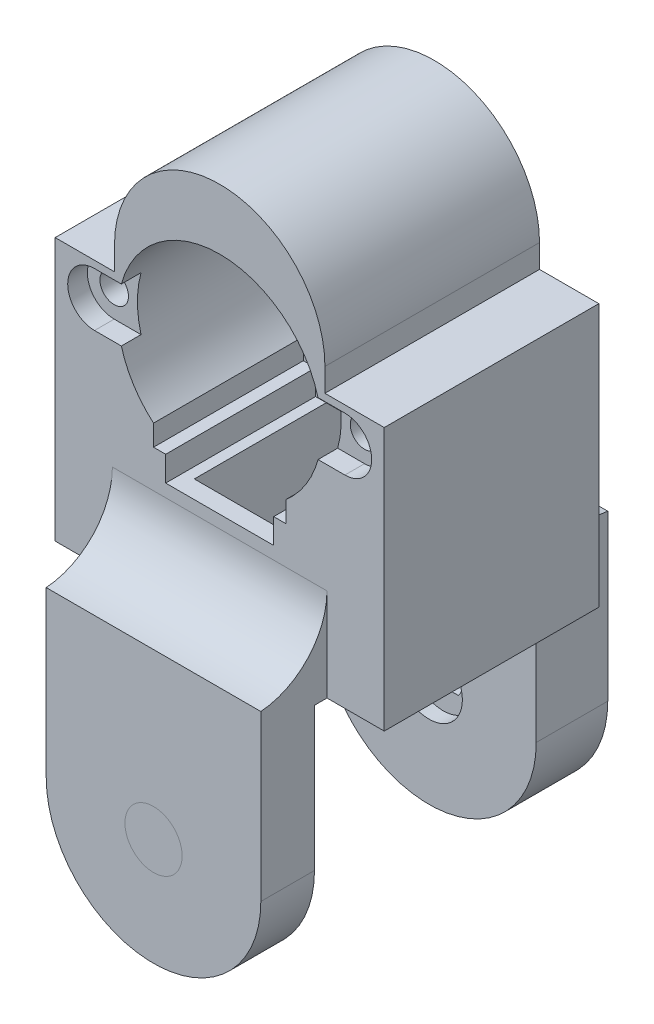
from build123d import *

# Parameters (mm, degrees)
BOSS_EXTRUDE1_DEPTH      = 20.95
BOSS_EXTRUDE2_START      = -9.05
BOSS_EXTRUDE2_DEPTH      = 9.05
SKETCH6_R                = 2
CUT_EXTRUDE2_DEPTH       = 10
CUT_EXTRUDE3_DEPTH       = 2.75
CUT_EXTRUDE4_DEPTH       = 67.499081444
CUT_EXTRUDE4_DEPTH_BACK  = 67.499081444
SKETCH8_W                = 8.290514233
SKETCH8_H                = 3.25
SKETCH11_R               = 11.15
BEARING_HOLE_DEPTH       = 7.3
SKETCH9_W                = 12.1
SKETCH9_H                = 21.5
WIRE_HOLE_DEPTH          = 62.170258319
SKETCH12_W               = 46
SKETCH12_H               = 30
BOSS_EXTRUDE3_DEPTH      = 0.0001
BOSS_EXTRUDE4_DEPTH      = 9.25
BOSS_EXTRUDE4_DEPTH_BACK = 39.25
SKETCH14_W               = 31
SKETCH14_H               = 35
CUT_EXTRUDE5_DEPTH       = 74.138005393
SKETCH15_R               = 4
CUT_EXTRUDE6_DEPTH       = 77.644489906
SKETCH17_R               = 6.169612062
BOSS_EXTRUDE5_DEPTH      = 10
SKETCH18_R               = 4
BOSS_EXTRUDE6_DEPTH      = 14
SKETCH19_R               = 4.675
CUT_EXTRUDE7_DEPTH       = 2
BOSS_EXTRUDE7_START      = -39.25
SKETCH20_W               = 30
SKETCH20_H               = 3
BOSS_EXTRUDE7_DEPTH      = 48.5
FILLET1_R                = 10


with BuildPart() as part:
    # Sketch2 → Boss-Extrude1 (new body)
    with BuildSketch(Plane.XY):
        with BuildLine():
            Line((-14.709485767, 40), (-23, 40))
            Line((-23, 40), (-23, 0))
            Line((-23, 0), (23, 0))
            Line((23, 0), (23, 40))
            Line((23, 40), (14.709485767, 40))
            ThreePointArc((14.709485767, 40), (0, 54.709485767), (-14.709485767, 40))
        make_face()
        with BuildLine():
            Line((-7.55, 18.241114036), (-7.55, 14.75))
            Line((-7.55, 14.75), (7.55, 14.75))
            Line((7.55, 14.75), (7.55, 18.241114036))
            Line((7.55, 18.241114036), (9.25, 18.241114036))
            Line((9.25, 18.241114036), (9.25, 21.160258306))
            ThreePointArc((9.25, 21.160258306), (0, 46.25), (-9.25, 21.160258306))
            Line((-9.25, 21.160258306), (-9.25, 18.241114036))
            Line((-9.25, 18.241114036), (-7.55, 18.241114036))
        make_face(mode=Mode.SUBTRACT)
    extrude(amount=BOSS_EXTRUDE1_DEPTH)

    # Sketch3 → Boss-Extrude2 (add)
    with BuildSketch(Plane.XY.offset(BOSS_EXTRUDE2_START)):
        with BuildLine():
            Line((-14.709485767, 40), (-23, 40))
            Line((-23, 40), (-23, 0))
            Line((-23, 0), (23, 0))
            Line((23, 0), (23, 40))
            Line((23, 40), (14.709485767, 40))
            ThreePointArc((14.709485767, 40), (0, 54.709485767), (-14.709485767, 40))
        make_face()
    extrude(amount=BOSS_EXTRUDE2_DEPTH)

    # Sketch6 → Cut-Extrude2 (cut)
    with BuildSketch(Plane.XY.offset(20.95)):
        with Locations((-17.5, 32)):
            Circle(SKETCH6_R)
        with Locations((17.5, 32)):
            Circle(SKETCH6_R)
    extrude(amount=-CUT_EXTRUDE2_DEPTH, mode=Mode.SUBTRACT)

    # Sketch7 → Cut-Extrude3 (cut)
    with BuildSketch(Plane.XY.offset(20.95)):
        with BuildLine():
            Line((-17.5, 35.75), (17.5, 35.75))
            ThreePointArc((17.5, 35.75), (21.25, 32), (17.5, 28.25))
            Line((17.5, 28.25), (-17.5, 28.25))
            ThreePointArc((-17.5, 28.25), (-21.25, 32), (-17.5, 35.75))
        make_face()
    extrude(amount=-CUT_EXTRUDE3_DEPTH, mode=Mode.SUBTRACT)

    # Sketch8 → Cut-Extrude4 (cut, two sides: drawn at the far end of the back side and taken through both)
    with BuildSketch(Plane.XY.offset(20.95).offset(-CUT_EXTRUDE4_DEPTH_BACK)):
        with Locations((-18.854742884, 38.375)):
            Rectangle(SKETCH8_W, SKETCH8_H)
        with Locations((18.854742884, 38.375)):
            Rectangle(SKETCH8_W, SKETCH8_H)
    extrude(amount=CUT_EXTRUDE4_DEPTH + CUT_EXTRUDE4_DEPTH_BACK, mode=Mode.SUBTRACT)

    # Sketch11 → Bearing Hole (cut)
    with BuildSketch(Plane(origin=(0, 0, -9.05), x_dir=(-1, 0, 0), z_dir=(0, 0, -1))):
        with Locations((0, 40)):
            Circle(SKETCH11_R)
    extrude(amount=-BEARING_HOLE_DEPTH, mode=Mode.SUBTRACT)

    # Sketch9 → Wire Hole (cut, through all)
    with BuildSketch(Plane(origin=(0, 14.75, -19.25), x_dir=(-1, 0, 0), z_dir=(0, 1, 0))):
        with Locations((0, 26.95)):
            Rectangle(SKETCH9_W, SKETCH9_H)
    extrude(amount=-WIRE_HOLE_DEPTH, mode=Mode.SUBTRACT)

    # Sketch12 → Boss-Extrude3 (add)
    with BuildSketch(Plane.XZ):
        with Locations((0, 5.95)):
            Rectangle(SKETCH12_W, SKETCH12_H)
    extrude(amount=BOSS_EXTRUDE3_DEPTH)

    # Sketch13 → Boss-Extrude4 (add, two sides: drawn at the far end of the back side and taken through both)
    with BuildSketch(Plane.XY.offset(20.95).offset(-BOSS_EXTRUDE4_DEPTH_BACK)):
        with BuildLine():
            Line((-15, -0.0001), (15, -0.0001))
            Line((15, -0.0001), (15, -20.0001))
            ThreePointArc((15, -20.0001), (0, -35.0001), (-15, -20.0001))
            Line((-15, -20.0001), (-15, -0.0001))
        make_face()
    extrude(amount=BOSS_EXTRUDE4_DEPTH + BOSS_EXTRUDE4_DEPTH_BACK)

    # Sketch14 → Cut-Extrude5 (cut, through all)
    with BuildSketch(Plane.ZY.offset(15)):
        with Locations((7.2, -17.5001)):
            Rectangle(SKETCH14_W, SKETCH14_H)
    extrude(amount=-CUT_EXTRUDE5_DEPTH, mode=Mode.SUBTRACT)


with BuildPart() as cut_extrude5_piece_1:
    # of the separate pieces the step leaves, piece 1, a body of its own (cut_extrude5_pieces)
    add(part.part.solids().sort_by_distance((14.709485767, 40, 20.95))[0])


with BuildPart() as cut_extrude5_piece_2:
    # of the separate pieces the step leaves, piece 2, a body of its own (cut_extrude5_pieces)
    add(part.part.solids().sort_by_distance((-15, -0.0001, 30.2))[0])


with BuildPart() as cut_extrude6_tool:
    # Sketch15 → Cut-Extrude6 (new, through all)
    with BuildSketch(Plane.XY.offset(30.2)):
        with Locations((0, -20.0001)):
            Circle(SKETCH15_R)
    extrude(amount=-CUT_EXTRUDE6_DEPTH)


with BuildPart() as cut_extrude5_piece_1_1:
    add(cut_extrude5_piece_1.part)

    # Cut-Extrude6: cut by cut_extrude6_tool
    add(cut_extrude6_tool.part, mode=Mode.SUBTRACT)

    # Sketch17 → Boss-Extrude5 (add)
    with BuildSketch(Plane(origin=(0, 0, -18.3), x_dir=(-1, 0, 0), z_dir=(0, 0, -1))):
        with Locations((0, -20.0001)):
            Circle(SKETCH17_R)
        with BuildLine():
            Line((-2.121320344, -18.2501), (2.121320344, -18.2501))
            ThreePointArc((2.121320344, -18.2501), (2.75, -20.0001), (2.121320344, -21.7501))
            Line((2.121320344, -21.7501), (-2.121320344, -21.7501))
            ThreePointArc((-2.121320344, -21.7501), (-2.75, -20.0001), (-2.121320344, -18.2501))
        make_face(mode=Mode.SUBTRACT)
    extrude(amount=-BOSS_EXTRUDE5_DEPTH)

    # Sketch19 → Cut-Extrude7 (cut)
    with BuildSketch(Plane.XY.offset(-8.3)):
        with Locations((0, -20.0001)):
            Circle(SKETCH19_R)
    extrude(amount=-CUT_EXTRUDE7_DEPTH, mode=Mode.SUBTRACT)



with BuildPart() as cut_extrude5_piece_2_1:
    add(cut_extrude5_piece_2.part)

    # Cut-Extrude6: cut by cut_extrude6_tool
    add(cut_extrude6_tool.part, mode=Mode.SUBTRACT)


with BuildPart() as body_3:
    # Sketch18 → Boss-Extrude6 (new body)
    with BuildSketch(Plane.XY.offset(30.2)):
        with Locations((0, -20.0001)):
            Circle(SKETCH18_R)
    extrude(amount=-BOSS_EXTRUDE6_DEPTH)


with BuildPart() as cut_extrude5_piece_1_2:
    add(cut_extrude5_piece_1_1.part)

    add(cut_extrude5_piece_2_1.part)  # Boss-Extrude7 merges Cut-Extrude5 piece 2
    # Sketch20 → Boss-Extrude7 (add)
    with BuildSketch(Plane.XY.offset(20.95).offset(BOSS_EXTRUDE7_START)):
        with Locations((0, 1.4999)):
            Rectangle(SKETCH20_W, SKETCH20_H)
    extrude(amount=BOSS_EXTRUDE7_DEPTH)

    # Fillet1
    # the kernel refuses this fillet: 10 mm, written as the material it adds along each edge
    with BuildSketch(Plane(origin=(-15, 2.9999, -9.05), x_dir=(0, 0, -1), z_dir=(1, 0, 0))) as fillet1_piece_1:
        with BuildLine():
            CenterArc((10, 9.971835338), FILLET1_R, 180, 85.698777695)
            Line((0, 9.971835338), (-0.2, 9.971835338))
            Line((-0.2, 9.971835338), (-0.2, 0))
            Line((-0.2, 0), (0, -0.2))
            ThreePointArc((0, -0.2), (4.625, -0.2), (9.235, -0.199436707))
            Line((9.235, -0.199436707), (9.25, 0))
        make_face()
    extrude(amount=30)
    with BuildSketch(Plane(origin=(-15, 2.9999, 20.95), x_dir=(0, 1, 0), z_dir=(1, 0, 0))) as fillet1_piece_2:
        with BuildLine():
            CenterArc((9.971835338, 10), FILLET1_R, 184.301222305, 85.698777695)
            Line((0, 9.25), (-0.199436707, 9.235))
            ThreePointArc((-0.199436707, 9.235), (-0.2, 4.625), (-0.2, 0))
            Line((-0.2, 0), (0, -0.2))
            Line((0, -0.2), (9.971835338, -0.2))
            Line((9.971835338, -0.2), (9.971835338, 0))
        make_face()
    extrude(amount=30)


solid = Compound([body_3.part, cut_extrude5_piece_1_2.part])
